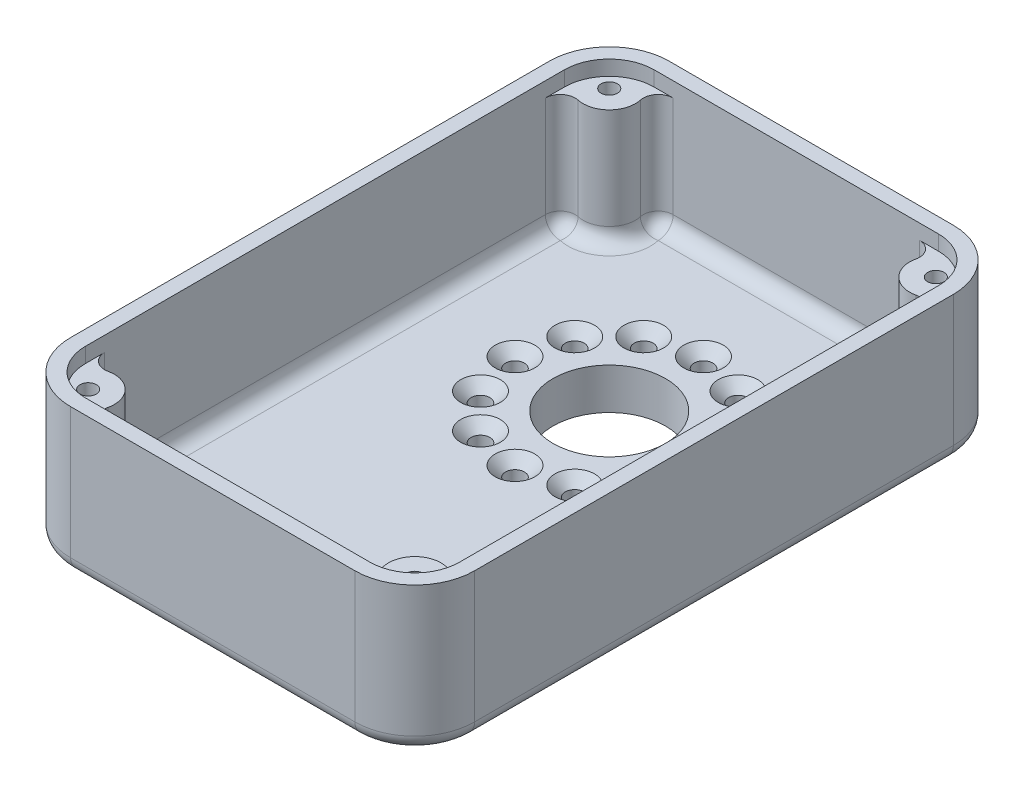
from build123d import *

# Parameters (mm, degrees)
BOSS_EXTRUDE1_START           = 2.54
SKETCH4_R                     = 9.5504
BOSS_EXTRUDE1_DEPTH           = 2.54
CSK_FOR_M3_SFHCS1_D           = 3.2
CSK_FOR_M3_SFHCS1_CSINK_D     = 6.72
CSK_FOR_M3_SFHCS1_CSINK_ANGLE = 90
BOSS_EXTRUDE4_START           = 22.225
BOSS_EXTRUDE4_DEPTH           = 22.225
FILLET1_R                     = 2.54
SKETCH8_R                     = 4.445
SKETCH8_R_2                   = 1.3890625
BOSS_EXTRUDE5_DEPTH           = 19.685
FILLET3_R                     = 2.54
FILLET4_R                     = 2.54


with BuildPart() as part:
    # Sketch1 → Revolve1 (revolve)
    with BuildSketch(Plane.XY, mode=Mode.PRIVATE) as revolve1_sk:
        Polygon((-9.5504, 0), (-20.574, 0), (-20.574, -5.08), (-13.208, -5.08), (-13.208, -4.445), (-9.5504, -4.445), align=None)
    revolve(revolve1_sk.sketch.rotate(Axis((0, 0, 0), (0, 1, 0)), 270), axis=Axis((0, 0, 0), (0, 1, 0)))

    # Sketch4 → Boss-Extrude1 (add)
    with BuildSketch(Plane(origin=(0, 0, 0), x_dir=(1, 0, 0), z_dir=(0, 1, 0)).offset(BOSS_EXTRUDE1_START)):
        with BuildLine():
            Line((-24.13, -67.31), (24.13, -67.31))
            ThreePointArc((24.13, -67.31), (31.314204897, -64.334204897), (34.29, -57.15))
            Line((34.29, -57.15), (34.29, 24.13))
            ThreePointArc((34.29, 24.13), (31.314204897, 31.314204897), (24.13, 34.29))
            Line((24.13, 34.29), (-24.13, 34.29))
            ThreePointArc((-24.13, 34.29), (-31.314204897, 31.314204897), (-34.29, 24.13))
            Line((-34.29, 24.13), (-34.29, -57.15))
            ThreePointArc((-34.29, -57.15), (-31.314204897, -64.334204897), (-24.13, -67.31))
        make_face()
        Circle(SKETCH4_R, mode=Mode.SUBTRACT)
    extrude(amount=-BOSS_EXTRUDE1_DEPTH)

    # CSK for M3 SFHCS1 (through all)
    with Locations(Plane(origin=(0, 2.54, 0), x_dir=(1, 0, 0), z_dir=(0, 1, 0))):
        with Locations((-13.858138511, -8.001), (-16.002, 0), (-13.858138511, 8.001), (-8.001, 13.858138511), (0, 16.002), (8.001, 13.858138511), (13.858138511, 8.001), (16.002, 0), (13.858138511, -8.001), (8.001, -13.858138511), (0, -16.002), (-8.001, -13.858138511)):
            CounterSinkHole(CSK_FOR_M3_SFHCS1_D / 2, CSK_FOR_M3_SFHCS1_CSINK_D / 2, counter_sink_angle=CSK_FOR_M3_SFHCS1_CSINK_ANGLE)

    # Sketch6 → Boss-Extrude4 (add)
    with BuildSketch(Plane(origin=(0, 2.54, 0), x_dir=(1, 0, 0), z_dir=(0, 1, 0)).offset(BOSS_EXTRUDE4_START)):
        with BuildLine():
            Line((24.13, 34.29), (-24.13, 34.29))
            ThreePointArc((-24.13, 34.29), (-31.314204897, 31.314204897), (-34.29, 24.13))
            Line((-34.29, 24.13), (-34.29, -57.15))
            ThreePointArc((-34.29, -57.15), (-31.314204897, -64.334204897), (-24.13, -67.31))
            Line((-24.13, -67.31), (24.13, -67.31))
            ThreePointArc((24.13, -67.31), (31.314204897, -64.334204897), (34.29, -57.15))
            Line((34.29, -57.15), (34.29, 24.13))
            ThreePointArc((34.29, 24.13), (31.314204897, 31.314204897), (24.13, 34.29))
        make_face()
        with BuildLine():
            Line((24.13, 31.75), (-24.13, 31.75))
            ThreePointArc((-24.13, 31.75), (-29.518153673, 29.518153673), (-31.75, 24.13))
            Line((-31.75, 24.13), (-31.75, -57.15))
            ThreePointArc((-31.75, -57.15), (-29.518153673, -62.538153673), (-24.13, -64.77))
            Line((-24.13, -64.77), (24.13, -64.77))
            ThreePointArc((24.13, -64.77), (29.518153673, -62.538153673), (31.75, -57.15))
            Line((31.75, -57.15), (31.75, 24.13))
            ThreePointArc((31.75, 24.13), (29.518153673, 29.518153673), (24.13, 31.75))
        make_face(mode=Mode.SUBTRACT)
    extrude(amount=-BOSS_EXTRUDE4_DEPTH)

    # Fillet1
    fillet1_edges = [part.edges().sort_by_distance(p)[0] for p in [
        (-31.314204897, 0, 64.334204897),
        (0, 0, 67.31),
        (31.314204897, 0, 64.334204897),
        (34.29, 0, 16.51),
        (31.314204897, 0, -31.314204897),
        (0, 0, -34.29),
        (-31.314204897, 0, -31.314204897),
        (-34.29, 0, 16.51),
    ]]
    fillet(fillet1_edges, radius=FILLET1_R)

    # Sketch8 → Boss-Extrude5 (add)
    # profile 1 of 4: a face of its own
    with BuildSketch(Plane(origin=(0, 2.54, 0), x_dir=(1, 0, 0), z_dir=(0, 1, 0))):
        with Locations((-27.722102448, -60.742102448)):
            Circle(SKETCH8_R)
        with Locations(Location((-27.722102448, -60.742102448, 0), (0, 0, 270))):
            Circle(SKETCH8_R_2, mode=Mode.SUBTRACT)
    # profile 2 of 4: a face of its own
    with BuildSketch(Plane(origin=(0, 2.54, 0), x_dir=(1, 0, 0), z_dir=(0, 1, 0))):
        with Locations((27.722102448, -60.742102448)):
            Circle(SKETCH8_R)
        with Locations(Location((27.722102448, -60.742102448, 0), (0, 0, 270))):
            Circle(SKETCH8_R_2, mode=Mode.SUBTRACT)
    # profile 3 of 4: a face of its own
    with BuildSketch(Plane(origin=(0, 2.54, 0), x_dir=(1, 0, 0), z_dir=(0, 1, 0))):
        with Locations((27.722102448, 27.722102448)):
            Circle(SKETCH8_R)
        with Locations(Location((27.722102448, 27.722102448, 0), (0, 0, 270))):
            Circle(SKETCH8_R_2, mode=Mode.SUBTRACT)
    # profile 4 of 4: a face of its own
    with BuildSketch(Plane(origin=(0, 2.54, 0), x_dir=(1, 0, 0), z_dir=(0, 1, 0))):
        with Locations((-27.722102448, 27.722102448)):
            Circle(SKETCH8_R)
        with Locations(Location((-27.722102448, 27.722102448, 0), (0, 0, 270))):
            Circle(SKETCH8_R_2, mode=Mode.SUBTRACT)
    extrude(amount=BOSS_EXTRUDE5_DEPTH)

    # Fillet3
    # the kernel refuses this fillet: 2.54 mm, written as the material it adds along each edge
    with BuildSketch(Plane(origin=(25.571770391, 2.54, 64.632359129), x_dir=(-0.5973974080073474, 0, -0.8019453453360166), z_dir=(0, 1, 0)), Plane(origin=(31.612359129, 2.54, -25.571770391), x_dir=(-0.8019453453360167, 0, 0.5973974080073472), z_dir=(0, 1, 0)), Plane(origin=(-25.571770391, 2.54, -31.612359129), x_dir=(0.5973974080073424, 0, 0.8019453453360202), z_dir=(0, 1, 0)), Plane(origin=(-31.612359129, 2.54, 58.591770391), x_dir=(0.8019453453360194, 0, -0.5973974080073438), z_dir=(0, 1, 0))) as fillet3_piece_1:
        with BuildLine():
            CenterArc((4.719009703, 2.313416024), FILLET3_R, 143.316272758, 102.298995101)
            Line((2.682068526, 3.83080544), (2.478374408, 3.982544382))
            ThreePointArc((2.478374408, 3.982544382), (0.547235321, 1.390186295), (-0.228725099, 0.110457363))
            Line((-0.228725099, 0.110457363), (0.104866882, -0.231341602))
            ThreePointArc((0.104866882, -0.231341602), (1.83517044, 0.142521958), (3.565473998, -0.231341602))
            Line((3.565473998, -0.231341602), (3.67034088, 0))
        make_face()
    extrude(amount=19.685)
    with BuildSketch(Plane(origin=(31.612359129, 2.54, 58.591770391), x_dir=(-0.8019453453360176, 0, -0.5973974080073462), z_dir=(0, 1, 0)), Plane(origin=(25.571770391, 2.54, -31.612359129), x_dir=(-0.5973974080073442, 0, 0.801945345336019), z_dir=(0, 1, 0)), Plane(origin=(-31.612359129, 2.54, -25.571770391), x_dir=(0.8019453453360176, 0, 0.5973974080073461), z_dir=(0, 1, 0)), Plane(origin=(-25.571770391, 2.54, 64.632359129), x_dir=(0.5973974080073453, 0, -0.8019453453360182), z_dir=(0, 1, 0))) as fillet3_piece_2:
        with BuildLine():
            CenterArc((4.719009703, -2.313416024), FILLET3_R, 114.384732141, 102.298995101)
            Line((2.682068526, -3.83080544), (2.478374408, -3.982544382))
            ThreePointArc((2.478374408, -3.982544382), (0.547235321, -1.390186295), (-0.228725099, -0.110457363))
            Line((-0.228725099, -0.110457363), (0.104866882, 0.231341602))
            ThreePointArc((0.104866882, 0.231341602), (1.83517044, -0.142521958), (3.565473998, 0.231341602))
            Line((3.565473998, 0.231341602), (3.67034088, 0))
        make_face()
    extrude(amount=19.685)

    # Fillet4
    fillet4_edges = [part.edges().sort_by_distance(p)[0] for p in [
        (0, 2.54, 64.77),
        (-24.579012806, 2.54, -24.579012806),
        (-31.75, 2.54, 16.51),
        (-24.579012806, 2.54, 57.599012806),
        (24.579012806, 2.54, 57.599012806),
        (31.75, 2.54, 16.51),
        (24.579012806, 2.54, -24.579012806),
        (0, 2.54, -31.75),
        (-22.875527809, 2.54, 63.823317877),
        (-30.803317877, 2.54, 55.895527809),
        (-22.875527809, 2.54, -30.803317877),
        (-30.803317877, 2.54, -22.875527809),
        (30.803317877, 2.54, -22.875527809),
        (22.875527809, 2.54, -30.803317877),
        (30.803317877, 2.54, 55.895527809),
        (22.875527809, 2.54, 63.823317877),
    ]]
    fillet(fillet4_edges, radius=FILLET4_R)


solid = part.part
